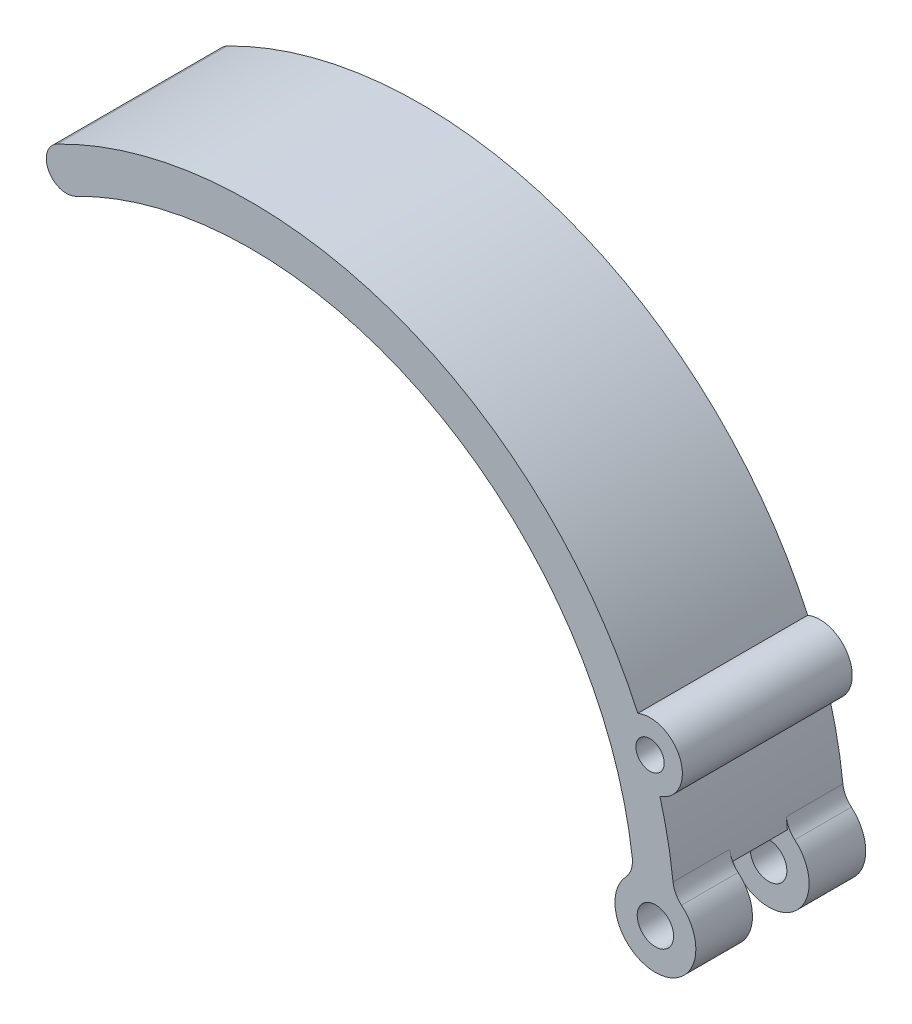
from build123d import *

# Parameters (mm, degrees)
EXTRU_MINCE1_DEPTH           = 21
ESQUISSE4_R                  = 4.9999999999999964
BOSS_EXTRU_2_DEPTH           = 21
ENL_V_MAT_EXTRU_2_DEPTH      = 79.88123984826811
ENL_V_MAT_EXTRU_2_DEPTH_BACK = 79.88123984826811
ESQUISSE5_R                  = 2.250000000000002
ENL_V_START                  = -7
ESQUISSE6_R                  = 4.9999999999999964
ENL_V_MAT_EXTRU_3_DEPTH      = 7
CONG_4_R                     = 3
CONG_6_R                     = 2.5
BOSS_EXTRU_3_START           = -21
BOSS_EXTRU_3_DEPTH           = 21
ENL_V_MAT_EXTRU_4_DEPTH      = 79.88123984826811
ENL_V_MAT_EXTRU_4_DEPTH_BACK = 79.88123984826811
ESQUISSE8_R                  = 1.7500000000000038


# Some blends are built 0.0001 mm under size
with BuildPart() as part:
    # Esquisse1 → Extru.-Mince1 (new body)
    with BuildSketch(Plane.XY):
        with BuildLine():
            ThreePointArc((52.49999999999999, 4.2e-16), (26.249999999999886, 45.46633369868308), (-26.250000000000224, 45.4663336986829))
            Line((-26.250000000000224, 45.4663336986829), (-23.750000000000203, 41.13620667976072))
            ThreePointArc((-23.750000000000203, 41.13620667976072), (23.749999999999897, 41.13620667976088), (47.49999999999999, -4.2e-16))
            Line((47.49999999999999, -4.2e-16), (52.49999999999999, 4.2e-16))
        make_face()
    extrude(amount=EXTRU_MINCE1_DEPTH)

    # Esquisse4 → Boss.-Extru.2 (add)
    with BuildSketch(Plane.XY.offset(21)):
        with Locations((50, 0)):
            Circle(ESQUISSE4_R)
    extrude(amount=-BOSS_EXTRU_2_DEPTH)

    # Esquisse5 → Enlèv. mat.-Extru.2 (cut, two sides: drawn at the far end of the back side and taken through both)
    with BuildSketch(Plane.XY.offset(21).offset(-ENL_V_MAT_EXTRU_2_DEPTH_BACK)):
        with Locations((50, 0)):
            Circle(ESQUISSE5_R)
    extrude(amount=ENL_V_MAT_EXTRU_2_DEPTH + ENL_V_MAT_EXTRU_2_DEPTH_BACK, mode=Mode.SUBTRACT)

    # Esquisse6 → Enlèv. mat.-Extru.3 (cut)
    with BuildSketch(Plane.XY.offset(21).offset(ENL_V_START)):
        with Locations((50, 0)):
            Circle(ESQUISSE6_R)
    extrude(amount=-ENL_V_MAT_EXTRU_3_DEPTH, mode=Mode.SUBTRACT)

    # Congé4
    # the kernel refuses this fillet: 3 mm, written as the material it adds along each edge
    with BuildSketch(Plane(origin=(47.3125, 4.216318743880709, 21), x_dir=(-0.7695454862891271, -0.6385920016192113, 0), z_dir=(0, 0, -1)), Plane(origin=(47.3125, 4.216318743880709, 7), x_dir=(-0.7695454862891271, -0.6385920016192113, 0), z_dir=(0, 0, -1))) as cong_4_piece_1:
        with BuildLine():
            CenterArc((1.6233202224653038, 2.976519037476766), CONG_4_R, 212.62585704290902, 50.20084903739968)
            ThreePointArc((-0.903307284750997, 1.359066274711204), (-0.45749046797105886, 0.6756536745373425), (0, 0))
            ThreePointArc((0, 0), (0.6243539317174114, 0.03913493753872468), (1.2487078634348219, 4e-17))
        make_face()
    extrude(amount=7)
    with BuildSketch(Plane(origin=(52.3125, 4.433096406576334, 21), x_dir=(0.8303156074241137, -0.5572934523820687, 0), z_dir=(0, 0, -1)), Plane(origin=(52.3125, 4.433096406576334, 7), x_dir=(0.8303156074241137, -0.5572934523820687, 0), z_dir=(0, 0, -1))) as cong_4_piece_2:
        with BuildLine():
            CenterArc((1.4311199733874571, -2.981766146537774), CONG_4_R, 96.3202818650538, 43.48897964287826)
            ThreePointArc((-0.8605810852935136, -1.0457634973555643), (-0.4269182279533879, -0.5256568983613493), (0, 0))
            ThreePointArc((0, 0), (0.5504307589951836, -0.03038975577037968), (1.100861517990363, 3e-17))
        make_face()
    extrude(amount=7)

    # Congé6
    cong_6_edges = [part.edges().sort_by_distance(p)[0] for p in [
        (-26.25000000000022, 45.46633369868291, 10.5),
        (-23.750000000000203, 41.13620667976072, 10.5),
    ]]
    fillet(cong_6_edges, radius=CONG_6_R - 0.0001)  # a hair under: the kernel refuses the full size

    # Esquisse7 → Boss.-Extru.3 (add)
    with BuildSketch(Plane.XY.offset(21).offset(BOSS_EXTRU_3_START)):
        with BuildLine():
            ThreePointArc((47.82358383341308, 21.659982209792123), (53.09263307440395, 19.324138097899965), (50.5577588361061, 14.147898129055626))
            ThreePointArc((50.5577588361061, 14.147898129055626), (49.33386259126014, 17.956057524597252), (47.82358383341308, 21.659982209792123))
        make_face()
    extrude(amount=BOSS_EXTRU_3_DEPTH)

    # Esquisse8 → Enlèv. mat.-Extru.4 (cut, two sides: drawn at the far end of the back side and taken through both)
    with BuildSketch(Plane.XY.offset(21).offset(-ENL_V_MAT_EXTRU_4_DEPTH_BACK)):
        with Locations((49.333862591260306, 17.956057524597313)):
            Circle(ESQUISSE8_R)
    extrude(amount=ENL_V_MAT_EXTRU_4_DEPTH + ENL_V_MAT_EXTRU_4_DEPTH_BACK, mode=Mode.SUBTRACT)


solid = part.part
